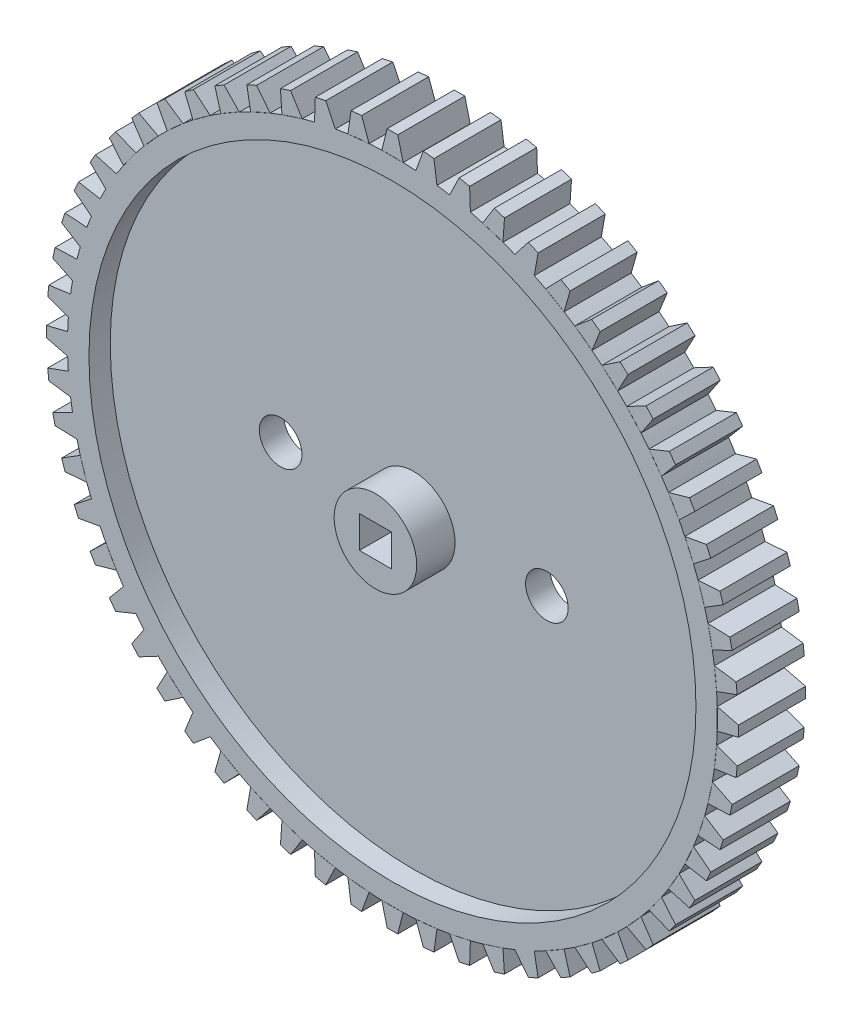
from build123d import *

# Parameters (mm, degrees)
BOSS_EXTRUDE1_DEPTH    = 6.3
SKETCH1_R              = 2
SKETCH1_W              = 3
SKETCH1_H              = 3
BOSS_EXTRUDE1_2_DEPTH  = 6.3
BOSS_EXTRUDE1_3_DEPTH  = 6.3
BOSS_EXTRUDE1_4_DEPTH  = 6.3
BOSS_EXTRUDE1_5_DEPTH  = 6.3
BOSS_EXTRUDE1_6_DEPTH  = 6.3
BOSS_EXTRUDE1_7_DEPTH  = 6.3
BOSS_EXTRUDE1_8_DEPTH  = 6.3
BOSS_EXTRUDE1_9_DEPTH  = 6.3
BOSS_EXTRUDE1_10_DEPTH = 6.3
BOSS_EXTRUDE1_11_DEPTH = 6.3
BOSS_EXTRUDE1_12_DEPTH = 6.3
BOSS_EXTRUDE1_13_DEPTH = 6.3
BOSS_EXTRUDE1_14_DEPTH = 6.3
BOSS_EXTRUDE1_15_DEPTH = 6.3
BOSS_EXTRUDE1_16_DEPTH = 6.3
BOSS_EXTRUDE1_17_DEPTH = 6.3
BOSS_EXTRUDE1_18_DEPTH = 6.3
BOSS_EXTRUDE1_19_DEPTH = 6.3
BOSS_EXTRUDE1_20_DEPTH = 6.3
BOSS_EXTRUDE1_21_DEPTH = 6.3
BOSS_EXTRUDE1_22_DEPTH = 6.3
BOSS_EXTRUDE1_23_DEPTH = 6.3
BOSS_EXTRUDE1_24_DEPTH = 6.3
BOSS_EXTRUDE1_25_DEPTH = 6.3
BOSS_EXTRUDE1_26_DEPTH = 6.3
BOSS_EXTRUDE1_27_DEPTH = 6.3
BOSS_EXTRUDE1_28_DEPTH = 6.3
BOSS_EXTRUDE1_29_DEPTH = 6.3
BOSS_EXTRUDE1_30_DEPTH = 6.3
BOSS_EXTRUDE1_31_DEPTH = 6.3
BOSS_EXTRUDE1_32_DEPTH = 6.3
BOSS_EXTRUDE1_33_DEPTH = 6.3
BOSS_EXTRUDE1_34_DEPTH = 6.3
BOSS_EXTRUDE1_35_DEPTH = 6.3
BOSS_EXTRUDE1_36_DEPTH = 6.3
BOSS_EXTRUDE1_37_DEPTH = 6.3
BOSS_EXTRUDE1_38_DEPTH = 6.3
BOSS_EXTRUDE1_39_DEPTH = 6.3
BOSS_EXTRUDE1_40_DEPTH = 6.3
BOSS_EXTRUDE1_41_DEPTH = 6.3
BOSS_EXTRUDE1_42_DEPTH = 6.3
BOSS_EXTRUDE1_43_DEPTH = 6.3
BOSS_EXTRUDE1_44_DEPTH = 6.3
SKETCH2_R              = 28.5
SKETCH2_R_2            = 3.875
CUT_EXTRUDE1_DEPTH     = 2
SKETCH3_R              = 28.496153619
SKETCH3_R_2            = 3.875
CUT_EXTRUDE2_DEPTH     = 2
SKETCH4_R              = 3.875
SKETCH4_W              = 3
SKETCH4_H              = 3
BOSS_EXTRUDE3_DEPTH    = 1.6
SKETCH5_R              = 3.875
SKETCH5_W              = 3
SKETCH5_H              = 3
BOSS_EXTRUDE4_DEPTH    = 1.6


with BuildPart() as part:
    # Sketch1 → Boss-Extrude1 (new body)
    with BuildSketch(Plane.XY):
        with BuildLine():
            Line((-0.5, 32.496153619), (-1, 30.496153619))
            ThreePointArc((-1, 30.496153619), (0, 30.512544724), (1, 30.496153619))
            Line((1, 30.496153619), (0.5, 32.496153619))
            Line((0.5, 32.496153619), (-0.5, 32.496153619))
        make_face()
    extrude(amount=BOSS_EXTRUDE1_DEPTH)


with BuildPart() as body_2:
    # Sketch1 → Boss-Extrude1 2 (new body)
    with BuildSketch(Plane.XY):
        with BuildLine():
            Line((1, 30.496153619), (-1, 30.496153619))
            ThreePointArc((-1, 30.496153619), (-1.596903206, 30.470728342), (-2.193194178, 30.433620961))
            Line((-2.193194178, 30.433620961), (-4.182237969, 30.224564035))
            ThreePointArc((-4.182237969, 30.224564035), (-4.773213611, 30.136884666), (-5.362359262, 30.037651184))
            Line((-5.362359262, 30.037651184), (-6.267256444, 31.88999054))
            Line((-6.267256444, 31.88999054), (-7.245404044, 31.68207885))
            Line((-7.245404044, 31.68207885), (-7.318654463, 29.621827803))
            ThreePointArc((-7.318654463, 29.621827803), (-7.897227689, 29.472854975), (-8.472773215, 29.312582615))
            Line((-8.472773215, 29.312582615), (-10.374886247, 28.694548626))
            ThreePointArc((-10.374886247, 28.694548626), (-10.934718088, 28.485914517), (-11.490357692, 28.266359257))
            Line((-11.490357692, 28.266359257), (-13.317448607, 27.452885971))
            ThreePointArc((-13.317448607, 27.452885971), (-13.852405428, 27.186876419), (-14.382051405, 26.910443751))
            Line((-14.382051405, 26.910443751), (-16.114102213, 25.910443751))
            ThreePointArc((-16.114102213, 25.910443751), (-16.618322914, 25.589973213), (-17.116172354, 25.259691793))
            Line((-17.116172354, 25.259691793), (-18.734206343, 24.084121288))
            ThreePointArc((-18.734206343, 24.084121288), (-19.202166578, 23.712700906), (-19.662764937, 23.332189365))
            Line((-19.662764937, 23.332189365), (-21.149054588, 21.993928152))
            ThreePointArc((-21.149054588, 21.993928152), (-21.575627286, 21.575627286), (-21.993928152, 21.149054588))
            Line((-21.993928152, 21.149054588), (-23.332189365, 19.662764937))
            ThreePointArc((-23.332189365, 19.662764937), (-23.712700906, 19.202166578), (-24.084121288, 18.734206343))
            Line((-24.084121288, 18.734206343), (-25.259691793, 17.116172354))
            ThreePointArc((-25.259691793, 17.116172354), (-25.589973213, 16.618322914), (-25.910443751, 16.114102213))
            Line((-25.910443751, 16.114102213), (-27.892494559, 16.681089511))
            Line((-27.892494559, 16.681089511), (-28.392494559, 15.815064107))
            Line((-28.392494559, 15.815064107), (-26.910443751, 14.382051405))
            ThreePointArc((-26.910443751, 14.382051405), (-27.186876419, 13.852405428), (-27.452885971, 13.317448607))
            Line((-27.452885971, 13.317448607), (-29.483345208, 13.674149165))
            Line((-29.483345208, 13.674149165), (-29.890081851, 12.760603707))
            Line((-29.890081851, 12.760603707), (-28.266359257, 11.490357692))
            ThreePointArc((-28.266359257, 11.490357692), (-28.485914517, 10.934718088), (-28.694548626, 10.374886247))
            Line((-28.694548626, 10.374886247), (-30.751170156, 10.517391978))
            Line((-30.751170156, 10.517391978), (-31.060187151, 9.566335462))
            Line((-31.060187151, 9.566335462), (-29.312582615, 8.472773215))
            ThreePointArc((-29.312582615, 8.472773215), (-29.472854975, 7.897227689), (-29.621827803, 7.318654463))
            Line((-29.621827803, 7.318654463), (-31.68207885, 7.245404044))
            Line((-31.68207885, 7.245404044), (-31.88999054, 6.267256444))
            Line((-31.88999054, 6.267256444), (-30.037651184, 5.362359262))
            ThreePointArc((-30.037651184, 5.362359262), (-30.136884666, 4.773213611), (-30.224564035, 4.182237969))
            Line((-30.224564035, 4.182237969), (-32.265872057, 3.894033948))
            Line((-32.265872057, 3.894033948), (-32.370400521, 2.899512052))
            Line((-32.370400521, 2.899512052), (-30.433620961, 2.193194178))
            ThreePointArc((-30.433620961, 2.193194178), (-30.470728342, 1.596903206), (-30.496153619, 1))
            Line((-30.496153619, 1), (-32.496153619, 0.5))
            Line((-32.496153619, 0.5), (-32.496153619, -0.5))
            Line((-32.496153619, -0.5), (-30.496153619, -1))
            ThreePointArc((-30.496153619, -1), (-30.470728342, -1.596903206), (-30.433620961, -2.193194178))
            Line((-30.433620961, -2.193194178), (-32.370400521, -2.899512052))
            Line((-32.370400521, -2.899512052), (-32.265872057, -3.894033948))
            Line((-32.265872057, -3.894033948), (-30.224564035, -4.182237969))
            ThreePointArc((-30.224564035, -4.182237969), (-30.136884666, -4.773213611), (-30.037651184, -5.362359262))
            Line((-30.037651184, -5.362359262), (-31.88999054, -6.267256444))
            Line((-31.88999054, -6.267256444), (-31.68207885, -7.245404044))
            Line((-31.68207885, -7.245404044), (-29.621827803, -7.318654463))
            ThreePointArc((-29.621827803, -7.318654463), (-29.472854975, -7.897227689), (-29.312582615, -8.472773215))
            Line((-29.312582615, -8.472773215), (-28.694548626, -10.374886247))
            ThreePointArc((-28.694548626, -10.374886247), (-28.485914517, -10.934718088), (-28.266359257, -11.490357692))
            Line((-28.266359257, -11.490357692), (-29.890081851, -12.760603707))
            Line((-29.890081851, -12.760603707), (-29.483345208, -13.674149165))
            Line((-29.483345208, -13.674149165), (-27.452885971, -13.317448607))
            ThreePointArc((-27.452885971, -13.317448607), (-27.186876419, -13.852405428), (-26.910443751, -14.382051405))
            Line((-26.910443751, -14.382051405), (-25.910443751, -16.114102213))
            ThreePointArc((-25.910443751, -16.114102213), (-25.589973213, -16.618322914), (-25.259691793, -17.116172354))
            Line((-25.259691793, -17.116172354), (-26.583833155, -18.696251356))
            Line((-26.583833155, -18.696251356), (-25.996047903, -19.50526835))
            Line((-25.996047903, -19.50526835), (-24.084121288, -18.734206343))
            ThreePointArc((-24.084121288, -18.734206343), (-23.712700906, -19.202166578), (-23.332189365, -19.662764937))
            Line((-23.332189365, -19.662764937), (-24.483913713, -21.372598562))
            Line((-24.483913713, -21.372598562), (-23.814783106, -22.115743388))
            Line((-23.814783106, -22.115743388), (-21.993928152, -21.149054588))
            ThreePointArc((-21.993928152, -21.149054588), (-21.575627286, -21.575627286), (-21.149054588, -21.993928152))
            Line((-21.149054588, -21.993928152), (-19.662764937, -23.332189365))
            ThreePointArc((-19.662764937, -23.332189365), (-19.202166578, -23.712700906), (-18.734206343, -24.084121288))
            Line((-18.734206343, -24.084121288), (-19.50526835, -25.996047903))
            Line((-19.50526835, -25.996047903), (-18.696251356, -26.583833155))
            Line((-18.696251356, -26.583833155), (-17.116172354, -25.259691793))
            ThreePointArc((-17.116172354, -25.259691793), (-16.618322914, -25.589973213), (-16.114102213, -25.910443751))
            Line((-16.114102213, -25.910443751), (-14.382051405, -26.910443751))
            ThreePointArc((-14.382051405, -26.910443751), (-13.852405428, -27.186876419), (-13.317448607, -27.452885971))
            Line((-13.317448607, -27.452885971), (-11.490357692, -28.266359257))
            ThreePointArc((-11.490357692, -28.266359257), (-10.934718088, -28.485914517), (-10.374886247, -28.694548626))
            Line((-10.374886247, -28.694548626), (-8.472773215, -29.312582615))
            ThreePointArc((-8.472773215, -29.312582615), (-7.897227689, -29.472854975), (-7.318654463, -29.621827803))
            Line((-7.318654463, -29.621827803), (-5.362359262, -30.037651184))
            ThreePointArc((-5.362359262, -30.037651184), (-4.773213611, -30.136884666), (-4.182237969, -30.224564035))
            Line((-4.182237969, -30.224564035), (-2.193194178, -30.433620961))
            ThreePointArc((-2.193194178, -30.433620961), (-1.596903206, -30.470728342), (-1, -30.496153619))
            Line((-1, -30.496153619), (1, -30.496153619))
            ThreePointArc((1, -30.496153619), (1.596903206, -30.470728342), (2.193194178, -30.433620961))
            Line((2.193194178, -30.433620961), (4.182237969, -30.224564035))
            ThreePointArc((4.182237969, -30.224564035), (4.773213611, -30.136884666), (5.362359262, -30.037651184))
            Line((5.362359262, -30.037651184), (7.318654463, -29.621827803))
            ThreePointArc((7.318654463, -29.621827803), (7.897227689, -29.472854975), (8.472773215, -29.312582615))
            Line((8.472773215, -29.312582615), (10.374886247, -28.694548626))
            ThreePointArc((10.374886247, -28.694548626), (10.934718088, -28.485914517), (11.490357692, -28.266359257))
            Line((11.490357692, -28.266359257), (12.760603707, -29.890081851))
            Line((12.760603707, -29.890081851), (13.674149165, -29.483345208))
            Line((13.674149165, -29.483345208), (13.317448607, -27.452885971))
            ThreePointArc((13.317448607, -27.452885971), (13.852405428, -27.186876419), (14.382051405, -26.910443751))
            Line((14.382051405, -26.910443751), (16.114102213, -25.910443751))
            ThreePointArc((16.114102213, -25.910443751), (16.618322914, -25.589973213), (17.116172354, -25.259691793))
            Line((17.116172354, -25.259691793), (18.734206343, -24.084121288))
            ThreePointArc((18.734206343, -24.084121288), (19.202166578, -23.712700906), (19.662764937, -23.332189365))
            Line((19.662764937, -23.332189365), (21.149054588, -21.993928152))
            ThreePointArc((21.149054588, -21.993928152), (21.575627286, -21.575627286), (21.993928152, -21.149054588))
            Line((21.993928152, -21.149054588), (23.332189365, -19.662764937))
            ThreePointArc((23.332189365, -19.662764937), (23.712700906, -19.202166578), (24.084121288, -18.734206343))
            Line((24.084121288, -18.734206343), (25.259691793, -17.116172354))
            ThreePointArc((25.259691793, -17.116172354), (25.589973213, -16.618322914), (25.910443751, -16.114102213))
            Line((25.910443751, -16.114102213), (26.910443751, -14.382051405))
            ThreePointArc((26.910443751, -14.382051405), (27.186876419, -13.852405428), (27.452885971, -13.317448607))
            Line((27.452885971, -13.317448607), (28.266359257, -11.490357692))
            ThreePointArc((28.266359257, -11.490357692), (28.485914517, -10.934718088), (28.694548626, -10.374886247))
            Line((28.694548626, -10.374886247), (29.312582615, -8.472773215))
            ThreePointArc((29.312582615, -8.472773215), (29.472854975, -7.897227689), (29.621827803, -7.318654463))
            Line((29.621827803, -7.318654463), (30.037651184, -5.362359262))
            ThreePointArc((30.037651184, -5.362359262), (30.136884666, -4.773213611), (30.224564035, -4.182237969))
            Line((30.224564035, -4.182237969), (30.433620961, -2.193194178))
            ThreePointArc((30.433620961, -2.193194178), (30.470728342, -1.596903206), (30.496153619, -1))
            Line((30.496153619, -1), (30.496153619, 1))
            ThreePointArc((30.496153619, 1), (30.470728342, 1.596903206), (30.433620961, 2.193194178))
            Line((30.433620961, 2.193194178), (30.224564035, 4.182237969))
            ThreePointArc((30.224564035, 4.182237969), (30.136884666, 4.773213611), (30.037651184, 5.362359262))
            Line((30.037651184, 5.362359262), (29.621827803, 7.318654463))
            ThreePointArc((29.621827803, 7.318654463), (29.472854975, 7.897227689), (29.312582615, 8.472773215))
            Line((29.312582615, 8.472773215), (28.694548626, 10.374886247))
            ThreePointArc((28.694548626, 10.374886247), (28.485914517, 10.934718088), (28.266359257, 11.490357692))
            Line((28.266359257, 11.490357692), (27.452885971, 13.317448607))
            ThreePointArc((27.452885971, 13.317448607), (27.186876419, 13.852405428), (26.910443751, 14.382051405))
            Line((26.910443751, 14.382051405), (25.910443751, 16.114102213))
            ThreePointArc((25.910443751, 16.114102213), (25.589973213, 16.618322914), (25.259691793, 17.116172354))
            Line((25.259691793, 17.116172354), (24.084121288, 18.734206343))
            ThreePointArc((24.084121288, 18.734206343), (23.712700906, 19.202166578), (23.332189365, 19.662764937))
            Line((23.332189365, 19.662764937), (21.993928152, 21.149054588))
            ThreePointArc((21.993928152, 21.149054588), (21.575627286, 21.575627286), (21.149054588, 21.993928152))
            Line((21.149054588, 21.993928152), (19.662764937, 23.332189365))
            ThreePointArc((19.662764937, 23.332189365), (19.202166578, 23.712700906), (18.734206343, 24.084121288))
            Line((18.734206343, 24.084121288), (17.116172354, 25.259691793))
            ThreePointArc((17.116172354, 25.259691793), (16.618322914, 25.589973213), (16.114102213, 25.910443751))
            Line((16.114102213, 25.910443751), (14.382051405, 26.910443751))
            ThreePointArc((14.382051405, 26.910443751), (13.852405428, 27.186876419), (13.317448607, 27.452885971))
            Line((13.317448607, 27.452885971), (13.674149165, 29.483345208))
            Line((13.674149165, 29.483345208), (12.760603707, 29.890081851))
            Line((12.760603707, 29.890081851), (11.490357692, 28.266359257))
            ThreePointArc((11.490357692, 28.266359257), (10.934718088, 28.485914517), (10.374886247, 28.694548626))
            Line((10.374886247, 28.694548626), (8.472773215, 29.312582615))
            ThreePointArc((8.472773215, 29.312582615), (7.897227689, 29.472854975), (7.318654463, 29.621827803))
            Line((7.318654463, 29.621827803), (7.245404044, 31.68207885))
            Line((7.245404044, 31.68207885), (6.267256444, 31.88999054))
            Line((6.267256444, 31.88999054), (5.362359262, 30.037651184))
            ThreePointArc((5.362359262, 30.037651184), (4.773213611, 30.136884666), (4.182237969, 30.224564035))
            Line((4.182237969, 30.224564035), (3.894033948, 32.265872057))
            Line((3.894033948, 32.265872057), (2.899512052, 32.370400521))
            Line((2.899512052, 32.370400521), (2.193194178, 30.433620961))
            ThreePointArc((2.193194178, 30.433620961), (1.596903206, 30.470728342), (1, 30.496153619))
        make_face()
        with Locations((-12.5, 0)):
            Circle(SKETCH1_R, mode=Mode.SUBTRACT)
        Rectangle(SKETCH1_W, SKETCH1_H, mode=Mode.SUBTRACT)
        with Locations((12.5, 0)):
            Circle(SKETCH1_R, mode=Mode.SUBTRACT)
    extrude(amount=BOSS_EXTRUDE1_2_DEPTH)

    # Sketch2 → Cut-Extrude1 (cut)
    with BuildSketch(Plane.XY.offset(6.3)):
        Circle(SKETCH2_R)
        Circle(SKETCH2_R_2, mode=Mode.SUBTRACT)
    extrude(amount=-CUT_EXTRUDE1_DEPTH, mode=Mode.SUBTRACT)

    # Sketch3 → Cut-Extrude2 (cut)
    with BuildSketch(Plane(origin=(0, 0, 0), x_dir=(-1, 0, 0), z_dir=(0, 0, -1))):
        Circle(SKETCH3_R)
        Circle(SKETCH3_R_2, mode=Mode.SUBTRACT)
    extrude(amount=-CUT_EXTRUDE2_DEPTH, mode=Mode.SUBTRACT)

    # Sketch4 → Boss-Extrude3 (add)
    with BuildSketch(Plane.XY.offset(6.3)):
        Circle(SKETCH4_R)
        Rectangle(SKETCH4_W, SKETCH4_H, mode=Mode.SUBTRACT)
    extrude(amount=BOSS_EXTRUDE3_DEPTH)

    # Sketch5 → Boss-Extrude4 (add)
    with BuildSketch(Plane(origin=(0, 0, 0), x_dir=(-1, 0, 0), z_dir=(0, 0, -1))):
        Circle(SKETCH5_R)
        Rectangle(SKETCH5_W, SKETCH5_H, mode=Mode.SUBTRACT)
    extrude(amount=BOSS_EXTRUDE4_DEPTH)


with BuildPart() as body_3:
    # Sketch1 → Boss-Extrude1 3 (new body)
    with BuildSketch(Plane.XY):
        with BuildLine():
            ThreePointArc((-4.182237969, 30.224564035), (-3.18942941, 30.345393811), (-2.193194178, 30.433620961))
            Line((-2.193194178, 30.433620961), (-2.899512052, 32.370400521))
            Line((-2.899512052, 32.370400521), (-3.894033948, 32.265872057))
            Line((-3.894033948, 32.265872057), (-4.182237969, 30.224564035))
        make_face()
    extrude(amount=BOSS_EXTRUDE1_3_DEPTH)


with BuildPart() as body_4:
    # Sketch1 → Boss-Extrude1 4 (new body)
    with BuildSketch(Plane.XY):
        with BuildLine():
            ThreePointArc((-10.374886247, 28.694548626), (-9.428894861, 29.019154488), (-8.472773215, 29.312582615))
            Line((-8.472773215, 29.312582615), (-9.566335462, 31.060187151))
            Line((-9.566335462, 31.060187151), (-10.517391978, 30.751170156))
            Line((-10.517391978, 30.751170156), (-10.374886247, 28.694548626))
        make_face()
    extrude(amount=BOSS_EXTRUDE1_4_DEPTH)


with BuildPart() as body_5:
    # Sketch1 → Boss-Extrude1 5 (new body)
    with BuildSketch(Plane.XY):
        with BuildLine():
            Line((9.566335462, 31.060187151), (8.472773215, 29.312582615))
            ThreePointArc((8.472773215, 29.312582615), (9.428894861, 29.019154488), (10.374886247, 28.694548626))
            Line((10.374886247, 28.694548626), (10.517391978, 30.751170156))
            Line((10.517391978, 30.751170156), (9.566335462, 31.060187151))
        make_face()
    extrude(amount=BOSS_EXTRUDE1_5_DEPTH)


with BuildPart() as body_6:
    # Sketch1 → Boss-Extrude1 6 (new body)
    with BuildSketch(Plane.XY):
        with BuildLine():
            ThreePointArc((-13.317448607, 27.452885971), (-12.410570013, 27.874596634), (-11.490357692, 28.266359257))
            Line((-11.490357692, 28.266359257), (-12.760603707, 29.890081851))
            Line((-12.760603707, 29.890081851), (-13.674149165, 29.483345208))
            Line((-13.674149165, 29.483345208), (-13.317448607, 27.452885971))
        make_face()
    extrude(amount=BOSS_EXTRUDE1_6_DEPTH)


with BuildPart() as body_7:
    # Sketch1 → Boss-Extrude1 7 (new body)
    with BuildSketch(Plane.XY):
        with BuildLine():
            ThreePointArc((-16.114102213, 25.910443751), (-15.256272362, 26.424638865), (-14.382051405, 26.910443751))
            Line((-14.382051405, 26.910443751), (-15.815064107, 28.392494559))
            Line((-15.815064107, 28.392494559), (-16.681089511, 27.892494559))
            Line((-16.681089511, 27.892494559), (-16.114102213, 25.910443751))
        make_face()
    extrude(amount=BOSS_EXTRUDE1_7_DEPTH)


with BuildPart() as body_8:
    # Sketch1 → Boss-Extrude1 8 (new body)
    with BuildSketch(Plane.XY):
        with BuildLine():
            Line((15.815064107, 28.392494559), (14.382051405, 26.910443751))
            ThreePointArc((14.382051405, 26.910443751), (15.256272362, 26.424638865), (16.114102213, 25.910443751))
            Line((16.114102213, 25.910443751), (16.681089511, 27.892494559))
            Line((16.681089511, 27.892494559), (15.815064107, 28.392494559))
        make_face()
    extrude(amount=BOSS_EXTRUDE1_8_DEPTH)


with BuildPart() as body_9:
    # Sketch1 → Boss-Extrude1 9 (new body)
    with BuildSketch(Plane.XY):
        with BuildLine():
            ThreePointArc((-18.734206343, 24.084121288), (-17.934823799, 24.685167223), (-17.116172354, 25.259691793))
            Line((-17.116172354, 25.259691793), (-18.696251356, 26.583833155))
            Line((-18.696251356, 26.583833155), (-19.50526835, 25.996047903))
            Line((-19.50526835, 25.996047903), (-18.734206343, 24.084121288))
        make_face()
    extrude(amount=BOSS_EXTRUDE1_9_DEPTH)


with BuildPart() as body_10:
    # Sketch1 → Boss-Extrude1 10 (new body)
    with BuildSketch(Plane.XY):
        with BuildLine():
            Line((18.696251356, 26.583833155), (17.116172354, 25.259691793))
            ThreePointArc((17.116172354, 25.259691793), (17.934823799, 24.685167223), (18.734206343, 24.084121288))
            Line((18.734206343, 24.084121288), (19.50526835, 25.996047903))
            Line((19.50526835, 25.996047903), (18.696251356, 26.583833155))
        make_face()
    extrude(amount=BOSS_EXTRUDE1_10_DEPTH)


with BuildPart() as body_11:
    # Sketch1 → Boss-Extrude1 11 (new body)
    with BuildSketch(Plane.XY):
        with BuildLine():
            ThreePointArc((-21.149054588, 21.993928152), (-20.416877553, 22.675239724), (-19.662764937, 23.332189365))
            Line((-19.662764937, 23.332189365), (-21.372598562, 24.483913713))
            Line((-21.372598562, 24.483913713), (-22.115743388, 23.814783106))
            Line((-22.115743388, 23.814783106), (-21.149054588, 21.993928152))
        make_face()
    extrude(amount=BOSS_EXTRUDE1_11_DEPTH)


with BuildPart() as body_12:
    # Sketch1 → Boss-Extrude1 12 (new body)
    with BuildSketch(Plane.XY):
        with BuildLine():
            Line((21.372598562, 24.483913713), (19.662764937, 23.332189365))
            ThreePointArc((19.662764937, 23.332189365), (20.416877553, 22.675239724), (21.149054588, 21.993928152))
            Line((21.149054588, 21.993928152), (22.115743388, 23.814783106))
            Line((22.115743388, 23.814783106), (21.372598562, 24.483913713))
        make_face()
    extrude(amount=BOSS_EXTRUDE1_12_DEPTH)


with BuildPart() as body_13:
    # Sketch1 → Boss-Extrude1 13 (new body)
    with BuildSketch(Plane.XY):
        with BuildLine():
            ThreePointArc((-23.332189365, 19.662764937), (-22.675239724, 20.416877553), (-21.993928152, 21.149054588))
            Line((-21.993928152, 21.149054588), (-23.814783106, 22.115743388))
            Line((-23.814783106, 22.115743388), (-24.483913713, 21.372598562))
            Line((-24.483913713, 21.372598562), (-23.332189365, 19.662764937))
        make_face()
    extrude(amount=BOSS_EXTRUDE1_13_DEPTH)


with BuildPart() as body_14:
    # Sketch1 → Boss-Extrude1 14 (new body)
    with BuildSketch(Plane.XY):
        with BuildLine():
            Line((23.814783106, 22.115743388), (21.993928152, 21.149054588))
            ThreePointArc((21.993928152, 21.149054588), (22.675239724, 20.416877553), (23.332189365, 19.662764937))
            Line((23.332189365, 19.662764937), (24.483913713, 21.372598562))
            Line((24.483913713, 21.372598562), (23.814783106, 22.115743388))
        make_face()
    extrude(amount=BOSS_EXTRUDE1_14_DEPTH)


with BuildPart() as body_15:
    # Sketch1 → Boss-Extrude1 15 (new body)
    with BuildSketch(Plane.XY):
        with BuildLine():
            ThreePointArc((-25.259691793, 17.116172354), (-24.685167223, 17.934823799), (-24.084121288, 18.734206343))
            Line((-24.084121288, 18.734206343), (-25.996047903, 19.50526835))
            Line((-25.996047903, 19.50526835), (-26.583833155, 18.696251356))
            Line((-26.583833155, 18.696251356), (-25.259691793, 17.116172354))
        make_face()
    extrude(amount=BOSS_EXTRUDE1_15_DEPTH)


with BuildPart() as body_16:
    # Sketch1 → Boss-Extrude1 16 (new body)
    with BuildSketch(Plane.XY):
        with BuildLine():
            Line((25.996047903, 19.50526835), (24.084121288, 18.734206343))
            ThreePointArc((24.084121288, 18.734206343), (24.685167223, 17.934823799), (25.259691793, 17.116172354))
            Line((25.259691793, 17.116172354), (26.583833155, 18.696251356))
            Line((26.583833155, 18.696251356), (25.996047903, 19.50526835))
        make_face()
    extrude(amount=BOSS_EXTRUDE1_16_DEPTH)


with BuildPart() as body_17:
    # Sketch1 → Boss-Extrude1 17 (new body)
    with BuildSketch(Plane.XY):
        with BuildLine():
            Line((27.892494559, 16.681089511), (25.910443751, 16.114102213))
            ThreePointArc((25.910443751, 16.114102213), (26.424638865, 15.256272362), (26.910443751, 14.382051405))
            Line((26.910443751, 14.382051405), (28.392494559, 15.815064107))
            Line((28.392494559, 15.815064107), (27.892494559, 16.681089511))
        make_face()
    extrude(amount=BOSS_EXTRUDE1_17_DEPTH)


with BuildPart() as body_18:
    # Sketch1 → Boss-Extrude1 18 (new body)
    with BuildSketch(Plane.XY):
        with BuildLine():
            Line((29.483345208, 13.674149165), (27.452885971, 13.317448607))
            ThreePointArc((27.452885971, 13.317448607), (27.874596634, 12.410570013), (28.266359257, 11.490357692))
            Line((28.266359257, 11.490357692), (29.890081851, 12.760603707))
            Line((29.890081851, 12.760603707), (29.483345208, 13.674149165))
        make_face()
    extrude(amount=BOSS_EXTRUDE1_18_DEPTH)


with BuildPart() as body_19:
    # Sketch1 → Boss-Extrude1 19 (new body)
    with BuildSketch(Plane.XY):
        with BuildLine():
            Line((30.751170156, 10.517391978), (28.694548626, 10.374886247))
            ThreePointArc((28.694548626, 10.374886247), (29.019154488, 9.428894861), (29.312582615, 8.472773215))
            Line((29.312582615, 8.472773215), (31.060187151, 9.566335462))
            Line((31.060187151, 9.566335462), (30.751170156, 10.517391978))
        make_face()
    extrude(amount=BOSS_EXTRUDE1_19_DEPTH)


with BuildPart() as body_20:
    # Sketch1 → Boss-Extrude1 20 (new body)
    with BuildSketch(Plane.XY):
        with BuildLine():
            Line((31.68207885, 7.245404044), (29.621827803, 7.318654463))
            ThreePointArc((29.621827803, 7.318654463), (29.845772414, 6.343914765), (30.037651184, 5.362359262))
            Line((30.037651184, 5.362359262), (31.88999054, 6.267256444))
            Line((31.88999054, 6.267256444), (31.68207885, 7.245404044))
        make_face()
    extrude(amount=BOSS_EXTRUDE1_20_DEPTH)


with BuildPart() as body_21:
    # Sketch1 → Boss-Extrude1 21 (new body)
    with BuildSketch(Plane.XY):
        with BuildLine():
            Line((32.265872057, 3.894033948), (30.224564035, 4.182237969))
            ThreePointArc((30.224564035, 4.182237969), (30.345393811, 3.18942941), (30.433620961, 2.193194178))
            Line((30.433620961, 2.193194178), (32.370400521, 2.899512052))
            Line((32.370400521, 2.899512052), (32.265872057, 3.894033948))
        make_face()
    extrude(amount=BOSS_EXTRUDE1_21_DEPTH)


with BuildPart() as body_22:
    # Sketch1 → Boss-Extrude1 22 (new body)
    with BuildSketch(Plane.XY):
        with BuildLine():
            Line((32.496153619, 0.5), (30.496153619, 1))
            ThreePointArc((30.496153619, 1), (30.512544724, 0), (30.496153619, -1))
            Line((30.496153619, -1), (32.496153619, -0.5))
            Line((32.496153619, -0.5), (32.496153619, 0.5))
        make_face()
    extrude(amount=BOSS_EXTRUDE1_22_DEPTH)


with BuildPart() as body_23:
    # Sketch1 → Boss-Extrude1 23 (new body)
    with BuildSketch(Plane.XY):
        with BuildLine():
            Line((32.370400521, -2.899512052), (30.433620961, -2.193194178))
            ThreePointArc((30.433620961, -2.193194178), (30.345393811, -3.18942941), (30.224564035, -4.182237969))
            Line((30.224564035, -4.182237969), (32.265872057, -3.894033948))
            Line((32.265872057, -3.894033948), (32.370400521, -2.899512052))
        make_face()
    extrude(amount=BOSS_EXTRUDE1_23_DEPTH)


with BuildPart() as body_24:
    # Sketch1 → Boss-Extrude1 24 (new body)
    with BuildSketch(Plane.XY):
        with BuildLine():
            Line((31.88999054, -6.267256444), (30.037651184, -5.362359262))
            ThreePointArc((30.037651184, -5.362359262), (29.845772414, -6.343914765), (29.621827803, -7.318654463))
            Line((29.621827803, -7.318654463), (31.68207885, -7.245404044))
            Line((31.68207885, -7.245404044), (31.88999054, -6.267256444))
        make_face()
    extrude(amount=BOSS_EXTRUDE1_24_DEPTH)


with BuildPart() as body_25:
    # Sketch1 → Boss-Extrude1 25 (new body)
    with BuildSketch(Plane.XY):
        with BuildLine():
            ThreePointArc((-28.694548626, -10.374886247), (-29.019154488, -9.428894861), (-29.312582615, -8.472773215))
            Line((-29.312582615, -8.472773215), (-31.060187151, -9.566335462))
            Line((-31.060187151, -9.566335462), (-30.751170156, -10.517391978))
            Line((-30.751170156, -10.517391978), (-28.694548626, -10.374886247))
        make_face()
    extrude(amount=BOSS_EXTRUDE1_25_DEPTH)


with BuildPart() as body_26:
    # Sketch1 → Boss-Extrude1 26 (new body)
    with BuildSketch(Plane.XY):
        with BuildLine():
            Line((31.060187151, -9.566335462), (29.312582615, -8.472773215))
            ThreePointArc((29.312582615, -8.472773215), (29.019154488, -9.428894861), (28.694548626, -10.374886247))
            Line((28.694548626, -10.374886247), (30.751170156, -10.517391978))
            Line((30.751170156, -10.517391978), (31.060187151, -9.566335462))
        make_face()
    extrude(amount=BOSS_EXTRUDE1_26_DEPTH)


with BuildPart() as body_27:
    # Sketch1 → Boss-Extrude1 27 (new body)
    with BuildSketch(Plane.XY):
        with BuildLine():
            Line((29.890081851, -12.760603707), (28.266359257, -11.490357692))
            ThreePointArc((28.266359257, -11.490357692), (27.874596634, -12.410570013), (27.452885971, -13.317448607))
            Line((27.452885971, -13.317448607), (29.483345208, -13.674149165))
            Line((29.483345208, -13.674149165), (29.890081851, -12.760603707))
        make_face()
    extrude(amount=BOSS_EXTRUDE1_27_DEPTH)


with BuildPart() as body_28:
    # Sketch1 → Boss-Extrude1 28 (new body)
    with BuildSketch(Plane.XY):
        with BuildLine():
            ThreePointArc((-25.910443751, -16.114102213), (-26.424638865, -15.256272362), (-26.910443751, -14.382051405))
            Line((-26.910443751, -14.382051405), (-28.392494559, -15.815064107))
            Line((-28.392494559, -15.815064107), (-27.892494559, -16.681089511))
            Line((-27.892494559, -16.681089511), (-25.910443751, -16.114102213))
        make_face()
    extrude(amount=BOSS_EXTRUDE1_28_DEPTH)


with BuildPart() as body_29:
    # Sketch1 → Boss-Extrude1 29 (new body)
    with BuildSketch(Plane.XY):
        with BuildLine():
            Line((28.392494559, -15.815064107), (26.910443751, -14.382051405))
            ThreePointArc((26.910443751, -14.382051405), (26.424638865, -15.256272362), (25.910443751, -16.114102213))
            Line((25.910443751, -16.114102213), (27.892494559, -16.681089511))
            Line((27.892494559, -16.681089511), (28.392494559, -15.815064107))
        make_face()
    extrude(amount=BOSS_EXTRUDE1_29_DEPTH)


with BuildPart() as body_30:
    # Sketch1 → Boss-Extrude1 30 (new body)
    with BuildSketch(Plane.XY):
        with BuildLine():
            Line((26.583833155, -18.696251356), (25.259691793, -17.116172354))
            ThreePointArc((25.259691793, -17.116172354), (24.685167223, -17.934823799), (24.084121288, -18.734206343))
            Line((24.084121288, -18.734206343), (25.996047903, -19.50526835))
            Line((25.996047903, -19.50526835), (26.583833155, -18.696251356))
        make_face()
    extrude(amount=BOSS_EXTRUDE1_30_DEPTH)


with BuildPart() as body_31:
    # Sketch1 → Boss-Extrude1 31 (new body)
    with BuildSketch(Plane.XY):
        with BuildLine():
            Line((24.483913713, -21.372598562), (23.332189365, -19.662764937))
            ThreePointArc((23.332189365, -19.662764937), (22.675239724, -20.416877553), (21.993928152, -21.149054588))
            Line((21.993928152, -21.149054588), (23.814783106, -22.115743388))
            Line((23.814783106, -22.115743388), (24.483913713, -21.372598562))
        make_face()
    extrude(amount=BOSS_EXTRUDE1_31_DEPTH)


with BuildPart() as body_32:
    # Sketch1 → Boss-Extrude1 32 (new body)
    with BuildSketch(Plane.XY):
        with BuildLine():
            ThreePointArc((-19.662764937, -23.332189365), (-20.416877553, -22.675239724), (-21.149054588, -21.993928152))
            Line((-21.149054588, -21.993928152), (-22.115743388, -23.814783106))
            Line((-22.115743388, -23.814783106), (-21.372598562, -24.483913713))
            Line((-21.372598562, -24.483913713), (-19.662764937, -23.332189365))
        make_face()
    extrude(amount=BOSS_EXTRUDE1_32_DEPTH)


with BuildPart() as body_33:
    # Sketch1 → Boss-Extrude1 33 (new body)
    with BuildSketch(Plane.XY):
        with BuildLine():
            Line((22.115743388, -23.814783106), (21.149054588, -21.993928152))
            ThreePointArc((21.149054588, -21.993928152), (20.416877553, -22.675239724), (19.662764937, -23.332189365))
            Line((19.662764937, -23.332189365), (21.372598562, -24.483913713))
            Line((21.372598562, -24.483913713), (22.115743388, -23.814783106))
        make_face()
    extrude(amount=BOSS_EXTRUDE1_33_DEPTH)


with BuildPart() as body_34:
    # Sketch1 → Boss-Extrude1 34 (new body)
    with BuildSketch(Plane.XY):
        with BuildLine():
            Line((19.50526835, -25.996047903), (18.734206343, -24.084121288))
            ThreePointArc((18.734206343, -24.084121288), (17.934823799, -24.685167223), (17.116172354, -25.259691793))
            Line((17.116172354, -25.259691793), (18.696251356, -26.583833155))
            Line((18.696251356, -26.583833155), (19.50526835, -25.996047903))
        make_face()
    extrude(amount=BOSS_EXTRUDE1_34_DEPTH)


with BuildPart() as body_35:
    # Sketch1 → Boss-Extrude1 35 (new body)
    with BuildSketch(Plane.XY):
        with BuildLine():
            ThreePointArc((-14.382051405, -26.910443751), (-15.256272362, -26.424638865), (-16.114102213, -25.910443751))
            Line((-16.114102213, -25.910443751), (-16.681089511, -27.892494559))
            Line((-16.681089511, -27.892494559), (-15.815064107, -28.392494559))
            Line((-15.815064107, -28.392494559), (-14.382051405, -26.910443751))
        make_face()
    extrude(amount=BOSS_EXTRUDE1_35_DEPTH)


with BuildPart() as body_36:
    # Sketch1 → Boss-Extrude1 36 (new body)
    with BuildSketch(Plane.XY):
        with BuildLine():
            Line((16.681089511, -27.892494559), (16.114102213, -25.910443751))
            ThreePointArc((16.114102213, -25.910443751), (15.256272362, -26.424638865), (14.382051405, -26.910443751))
            Line((14.382051405, -26.910443751), (15.815064107, -28.392494559))
            Line((15.815064107, -28.392494559), (16.681089511, -27.892494559))
        make_face()
    extrude(amount=BOSS_EXTRUDE1_36_DEPTH)


with BuildPart() as body_37:
    # Sketch1 → Boss-Extrude1 37 (new body)
    with BuildSketch(Plane.XY):
        with BuildLine():
            ThreePointArc((-11.490357692, -28.266359257), (-12.410570013, -27.874596634), (-13.317448607, -27.452885971))
            Line((-13.317448607, -27.452885971), (-13.674149165, -29.483345208))
            Line((-13.674149165, -29.483345208), (-12.760603707, -29.890081851))
            Line((-12.760603707, -29.890081851), (-11.490357692, -28.266359257))
        make_face()
    extrude(amount=BOSS_EXTRUDE1_37_DEPTH)


with BuildPart() as body_38:
    # Sketch1 → Boss-Extrude1 38 (new body)
    with BuildSketch(Plane.XY):
        with BuildLine():
            ThreePointArc((-8.472773215, -29.312582615), (-9.428894861, -29.019154488), (-10.374886247, -28.694548626))
            Line((-10.374886247, -28.694548626), (-10.517391978, -30.751170156))
            Line((-10.517391978, -30.751170156), (-9.566335462, -31.060187151))
            Line((-9.566335462, -31.060187151), (-8.472773215, -29.312582615))
        make_face()
    extrude(amount=BOSS_EXTRUDE1_38_DEPTH)


with BuildPart() as body_39:
    # Sketch1 → Boss-Extrude1 39 (new body)
    with BuildSketch(Plane.XY):
        with BuildLine():
            Line((10.517391978, -30.751170156), (10.374886247, -28.694548626))
            ThreePointArc((10.374886247, -28.694548626), (9.428894861, -29.019154488), (8.472773215, -29.312582615))
            Line((8.472773215, -29.312582615), (9.566335462, -31.060187151))
            Line((9.566335462, -31.060187151), (10.517391978, -30.751170156))
        make_face()
    extrude(amount=BOSS_EXTRUDE1_39_DEPTH)


with BuildPart() as body_40:
    # Sketch1 → Boss-Extrude1 40 (new body)
    with BuildSketch(Plane.XY):
        with BuildLine():
            ThreePointArc((-5.362359262, -30.037651184), (-6.343914765, -29.845772414), (-7.318654463, -29.621827803))
            Line((-7.318654463, -29.621827803), (-7.245404044, -31.68207885))
            Line((-7.245404044, -31.68207885), (-6.267256444, -31.88999054))
            Line((-6.267256444, -31.88999054), (-5.362359262, -30.037651184))
        make_face()
    extrude(amount=BOSS_EXTRUDE1_40_DEPTH)


with BuildPart() as body_41:
    # Sketch1 → Boss-Extrude1 41 (new body)
    with BuildSketch(Plane.XY):
        with BuildLine():
            Line((7.245404044, -31.68207885), (7.318654463, -29.621827803))
            ThreePointArc((7.318654463, -29.621827803), (6.343914765, -29.845772414), (5.362359262, -30.037651184))
            Line((5.362359262, -30.037651184), (6.267256444, -31.88999054))
            Line((6.267256444, -31.88999054), (7.245404044, -31.68207885))
        make_face()
    extrude(amount=BOSS_EXTRUDE1_41_DEPTH)


with BuildPart() as body_42:
    # Sketch1 → Boss-Extrude1 42 (new body)
    with BuildSketch(Plane.XY):
        with BuildLine():
            ThreePointArc((-2.193194178, -30.433620961), (-3.18942941, -30.345393811), (-4.182237969, -30.224564035))
            Line((-4.182237969, -30.224564035), (-3.894033948, -32.265872057))
            Line((-3.894033948, -32.265872057), (-2.899512052, -32.370400521))
            Line((-2.899512052, -32.370400521), (-2.193194178, -30.433620961))
        make_face()
    extrude(amount=BOSS_EXTRUDE1_42_DEPTH)


with BuildPart() as body_43:
    # Sketch1 → Boss-Extrude1 43 (new body)
    with BuildSketch(Plane.XY):
        with BuildLine():
            Line((3.894033948, -32.265872057), (4.182237969, -30.224564035))
            ThreePointArc((4.182237969, -30.224564035), (3.18942941, -30.345393811), (2.193194178, -30.433620961))
            Line((2.193194178, -30.433620961), (2.899512052, -32.370400521))
            Line((2.899512052, -32.370400521), (3.894033948, -32.265872057))
        make_face()
    extrude(amount=BOSS_EXTRUDE1_43_DEPTH)


with BuildPart() as body_44:
    # Sketch1 → Boss-Extrude1 44 (new body)
    with BuildSketch(Plane.XY):
        with BuildLine():
            ThreePointArc((1, -30.496153619), (0, -30.512544724), (-1, -30.496153619))
            Line((-1, -30.496153619), (-0.5, -32.496153619))
            Line((-0.5, -32.496153619), (0.5, -32.496153619))
            Line((0.5, -32.496153619), (1, -30.496153619))
        make_face()
    extrude(amount=BOSS_EXTRUDE1_44_DEPTH)


solid = Compound([part.part, body_2.part, body_3.part, body_4.part, body_5.part, body_6.part, body_7.part, body_8.part, body_9.part, body_10.part, body_11.part, body_12.part, body_13.part, body_14.part, body_15.part, body_16.part, body_17.part, body_18.part, body_19.part, body_20.part, body_21.part, body_22.part, body_23.part, body_24.part, body_25.part, body_26.part, body_27.part, body_28.part, body_29.part, body_30.part, body_31.part, body_32.part, body_33.part, body_34.part, body_35.part, body_36.part, body_37.part, body_38.part, body_39.part, body_40.part, body_41.part, body_42.part, body_43.part, body_44.part])
